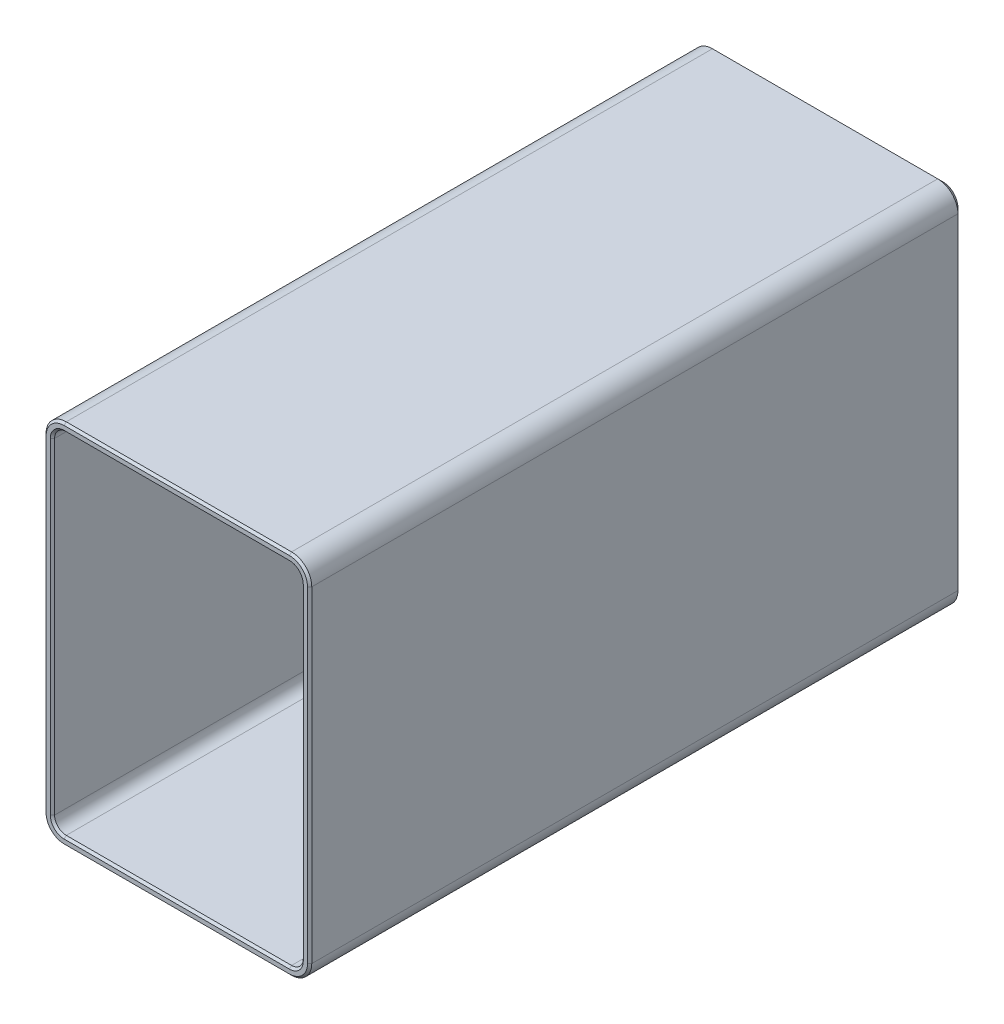
from build123d import *

# Parameters (mm, degrees)
WALLS_DEPTH            = 123
FLOOR_2_DEPTH          = 2.6
BOTTOM_CHAMFERS_SIZE   = 1
TOP_CHAMFERS_SIZE      = 0.4
INSIDE_BOTTOM_FILLET_R = 1


with BuildPart() as part:
    # Sketch1 → Walls (new body)
    with BuildSketch(Plane.XY):
        with BuildLine():
            Line((-25, 30.7), (-25, -30.7))
            ThreePointArc((-25, -30.7), (-23.887005769, -33.387005769), (-21.2, -34.5))
            Line((-21.2, -34.5), (21.2, -34.5))
            ThreePointArc((21.2, -34.5), (23.887005769, -33.387005769), (25, -30.7))
            Line((25, -30.7), (25, 30.7))
            ThreePointArc((25, 30.7), (23.887005769, 33.387005769), (21.2, 34.5))
            Line((21.2, 34.5), (-21.2, 34.5))
            ThreePointArc((-21.2, 34.5), (-23.887005769, 33.387005769), (-25, 30.7))
        make_face()
        with BuildLine():
            Line((-23.4, 30.7), (-23.4, -30.7))
            ThreePointArc((-23.4, -30.7), (-22.755634919, -32.255634919), (-21.2, -32.9))
            Line((-21.2, -32.9), (21.2, -32.9))
            ThreePointArc((21.2, -32.9), (22.755634919, -32.255634919), (23.4, -30.7))
            Line((23.4, -30.7), (23.4, 30.7))
            ThreePointArc((23.4, 30.7), (22.755634919, 32.255634919), (21.2, 32.9))
            Line((21.2, 32.9), (-21.2, 32.9))
            ThreePointArc((-21.2, 32.9), (-22.755634919, 32.255634919), (-23.4, 30.7))
        make_face(mode=Mode.SUBTRACT)
    extrude(amount=WALLS_DEPTH)

    # Sketch2 → Floor 2 (add)
    with BuildSketch(Plane(origin=(0, 0, 0), x_dir=(-1, 0, 0), z_dir=(0, 0, -1))):
        with BuildLine():
            Line((-25, 30.7), (-25, -30.7))
            ThreePointArc((-25, -30.7), (-23.887005769, -33.387005769), (-21.2, -34.5))
            Line((-21.2, -34.5), (21.2, -34.5))
            ThreePointArc((21.2, -34.5), (23.887005769, -33.387005769), (25, -30.7))
            Line((25, -30.7), (25, 30.7))
            ThreePointArc((25, 30.7), (23.887005769, 33.387005769), (21.2, 34.5))
            Line((21.2, 34.5), (-21.2, 34.5))
            ThreePointArc((-21.2, 34.5), (-23.887005769, 33.387005769), (-25, 30.7))
        make_face()
    extrude(amount=-FLOOR_2_DEPTH)

    # Bottom Chamfers
    bottom_chamfers_edges = [part.edges().sort_by_distance(p)[0] for p in [
        (0, 34.5, 0),
        (-23.887005769, 33.387005769, 0),
        (-25, 0, 0),
        (-23.887005769, -33.387005769, 0),
        (0, -34.5, 0),
        (23.887005769, -33.387005769, 0),
        (25, 0, 0),
        (23.887005769, 33.387005769, 0),
    ]]
    chamfer(bottom_chamfers_edges, length=BOTTOM_CHAMFERS_SIZE)

    # Top Chamfers
    top_chamfers_edges = [part.edges().sort_by_distance(p)[0] for p in [
        (-22.755634919, 32.255634919, 123),
        (-23.4, 0, 123),
        (-22.755634919, -32.255634919, 123),
        (0, -32.9, 123),
        (22.755634919, -32.255634919, 123),
        (23.4, 0, 123),
        (22.755634919, 32.255634919, 123),
        (0, 32.9, 123),
        (25, 0, 123),
        (23.887005769, -33.387005769, 123),
        (0, -34.5, 123),
        (-23.887005769, -33.387005769, 123),
        (-25, 0, 123),
        (-23.887005769, 33.387005769, 123),
        (0, 34.5, 123),
        (23.887005769, 33.387005769, 123),
    ]]
    chamfer(top_chamfers_edges, length=TOP_CHAMFERS_SIZE)

    # Inside Bottom Fillet
    inside_bottom_fillet_edges = [part.edges().sort_by_distance(p)[0] for p in [
        (23.4, 0, 2.6),
        (22.755634919, -32.255634919, 2.6),
        (0, -32.9, 2.6),
        (-22.755634919, -32.255634919, 2.6),
        (-23.4, 0, 2.6),
        (-22.755634919, 32.255634919, 2.6),
        (0, 32.9, 2.6),
        (22.755634919, 32.255634919, 2.6),
    ]]
    fillet(inside_bottom_fillet_edges, radius=INSIDE_BOTTOM_FILLET_R)


solid = part.part
